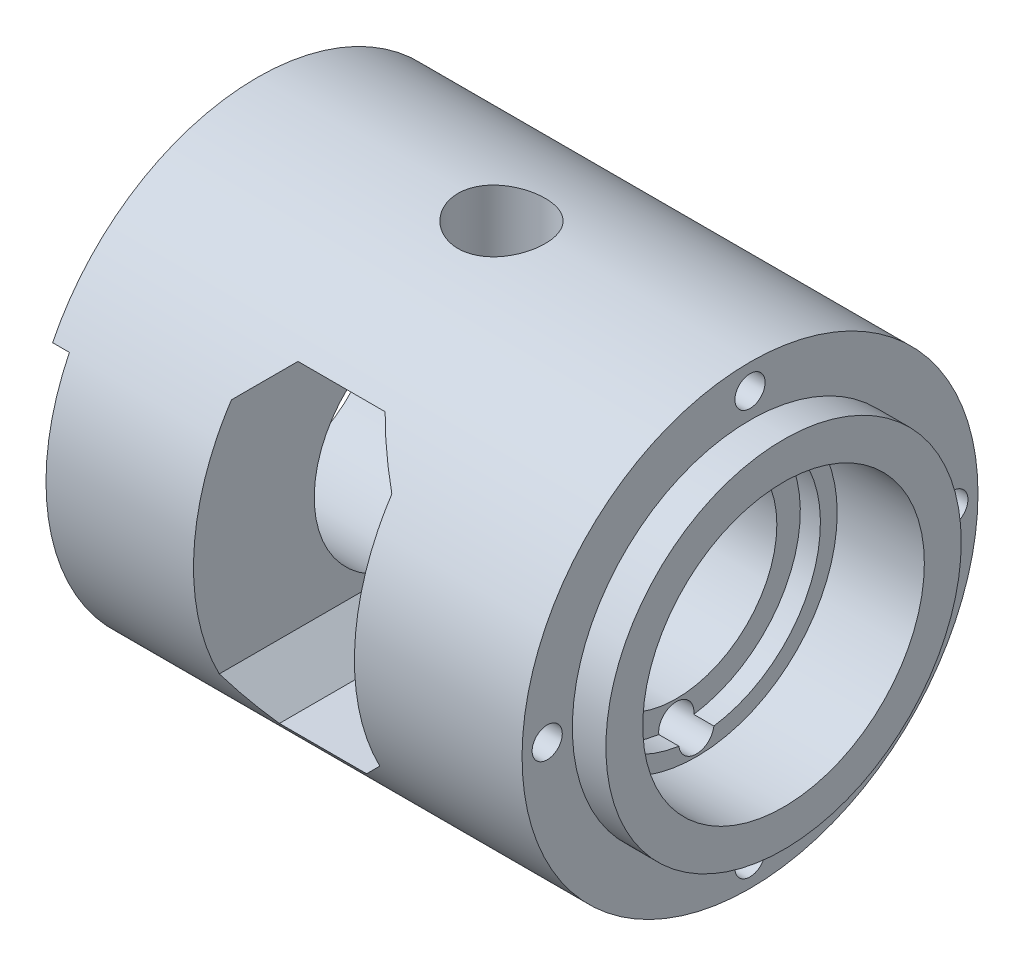
from build123d import *

# Parameters (mm, degrees)
SKETCH1_R                          = 68
BOSS_EXTRUDE1_DEPTH                = 157
CUT_EXTRUDE1_REACH                 = 186.111
SKETCH2_R                          = 26
SKETCH3_W                          = 136
SKETCH3_H                          = 98
CUT_EXTRUDE2_DEPTH                 = 5
CUT_EXTRUDE3_DEPTH                 = 44
SKETCH7_R                          = 42
CUT_EXTRUDE4_DEPTH                 = 26
SKETCH8_R                          = 37
CUT_EXTRUDE5_DEPTH                 = 6
SKETCH9_R                          = 30
CUT_EXTRUDE6_DEPTH                 = 28
CUT_EXTRUDE8_DEPTH                 = 71
TAP_DRILL_FOR_M1_2X0_25_TAP1_D     = 26
TAP_DRILL_FOR_M1_2X0_25_TAP1_DEPTH = 68
CUT_EXTRUDE9_START                 = -10
SKETCH27_R                         = 68
SKETCH27_R_2                       = 53
CUT_EXTRUDE9_DEPTH                 = 10
M8_CLEARANCE_HOLE1_D               = 9
M8_CLEARANCE_HOLE1_DEPTH           = 35
M8_CLEARANCE_HOLE1_TIP             = 2.703872786
M10_CLEARANCE_HOLE1_D              = 10.5
M10_CLEARANCE_HOLE1_DEPTH          = 15


with BuildPart() as part:
    # Sketch1 → Boss-Extrude1 (new body)
    with BuildSketch(Plane(origin=(0, 0, 0), x_dir=(0, 0, -1), z_dir=(1, 0, 0))):
        Circle(SKETCH1_R)
    extrude(amount=BOSS_EXTRUDE1_DEPTH)

    # Sketch2 → Cut-Extrude1 (cut, up to next)
    with BuildSketch(Plane.ZY, mode=Mode.PRIVATE) as cut_extrude1_sk1:
        Circle(SKETCH2_R)
    cut_extrude1_tool1 = extrude(cut_extrude1_sk1.sketch, amount=-CUT_EXTRUDE1_REACH, mode=Mode.PRIVATE) & part.part
    add(cut_extrude1_tool1.solids().sort_by_distance((0, 0, 0))[0], mode=Mode.SUBTRACT)

    # Sketch3 → Cut-Extrude2 (cut)
    with BuildSketch(Plane.ZY):
        with Locations((0, -19)):
            Rectangle(SKETCH3_W, SKETCH3_H)
    extrude(amount=-CUT_EXTRUDE2_DEPTH, mode=Mode.SUBTRACT)

    # Sketch4 → Cut-Extrude3 (cut)
    with BuildSketch(Plane.ZY.offset(-5)):
        with BuildLine():
            Line((-13.5, 29), (13.5, 29))
            ThreePointArc((13.5, 29), (0, -31.988279103), (-13.5, 29))
        make_face()
    extrude(amount=-CUT_EXTRUDE3_DEPTH, mode=Mode.SUBTRACT)

    # Sketch7 → Cut-Extrude4 (cut)
    with BuildSketch(Plane(origin=(157, 0, 0), x_dir=(0, 0, -1), z_dir=(1, 0, 0))):
        Circle(SKETCH7_R)
    extrude(amount=-CUT_EXTRUDE4_DEPTH, mode=Mode.SUBTRACT)

    # Sketch8 → Cut-Extrude5 (cut)
    with BuildSketch(Plane(origin=(131, 0, 0), x_dir=(0, 0, -1), z_dir=(1, 0, 0))):
        Circle(SKETCH8_R)
    extrude(amount=-CUT_EXTRUDE5_DEPTH, mode=Mode.SUBTRACT)

    # Sketch9 → Cut-Extrude6 (cut)
    with BuildSketch(Plane(origin=(125, 0, 0), x_dir=(0, 0, -1), z_dir=(1, 0, 0))):
        Circle(SKETCH9_R)
    extrude(amount=-CUT_EXTRUDE6_DEPTH, mode=Mode.SUBTRACT)

    # Sketch12 → Cut-Extrude8 (cut)
    with BuildSketch(Plane.XY.offset(68)):
        Polygon((49, 37.575966949), (49, -31.421583167), (59.873949205, -42.295532372), (85.873949205, -42.295532372), (97, -31.169481577), (97, 37.32386536), (85.873949205, 48.449916154), (59.873949205, 48.449916154), align=None)
    extrude(amount=-CUT_EXTRUDE8_DEPTH, mode=Mode.SUBTRACT)

    # Tap Drill for M1.2x0.25 Tap1
    with Locations(Plane(origin=(0, 68, 0), x_dir=(1, 0, 0), z_dir=(0, 1, 0))):
        with Locations((72.873949205, 0)):
            Hole(TAP_DRILL_FOR_M1_2X0_25_TAP1_D / 2, depth=TAP_DRILL_FOR_M1_2X0_25_TAP1_DEPTH)

    # Sketch27 → Cut-Extrude9 (cut)
    with BuildSketch(Plane(origin=(157, 0, 0), x_dir=(0, 0, -1), z_dir=(1, 0, 0)).offset(CUT_EXTRUDE9_START)):
        Circle(SKETCH27_R)
        Circle(SKETCH27_R_2, mode=Mode.SUBTRACT)
    extrude(amount=CUT_EXTRUDE9_DEPTH, mode=Mode.SUBTRACT)

    # M8 Clearance Hole1
    with Locations(Plane(origin=(147, 0, 0), x_dir=(0, 0, -1), z_dir=(1, 0, 0))):
        with Locations((-60.5, 0), (0, 60.5), (60.5, 0), (0, -60.5)):
            Hole(M8_CLEARANCE_HOLE1_D / 2, depth=M8_CLEARANCE_HOLE1_DEPTH)
            with Locations((0, 0, -(M8_CLEARANCE_HOLE1_DEPTH + M8_CLEARANCE_HOLE1_TIP / 2))):  # 118° drill point
                Cone(0, M8_CLEARANCE_HOLE1_D / 2, M8_CLEARANCE_HOLE1_TIP, mode=Mode.SUBTRACT)

    # M10 Clearance Hole1
    with Locations(Plane(origin=(131, 0, 0), x_dir=(0, 0, -1), z_dir=(1, 0, 0))):
        with Locations((0, -36)):
            Hole(M10_CLEARANCE_HOLE1_D / 2, depth=M10_CLEARANCE_HOLE1_DEPTH)


solid = part.part
